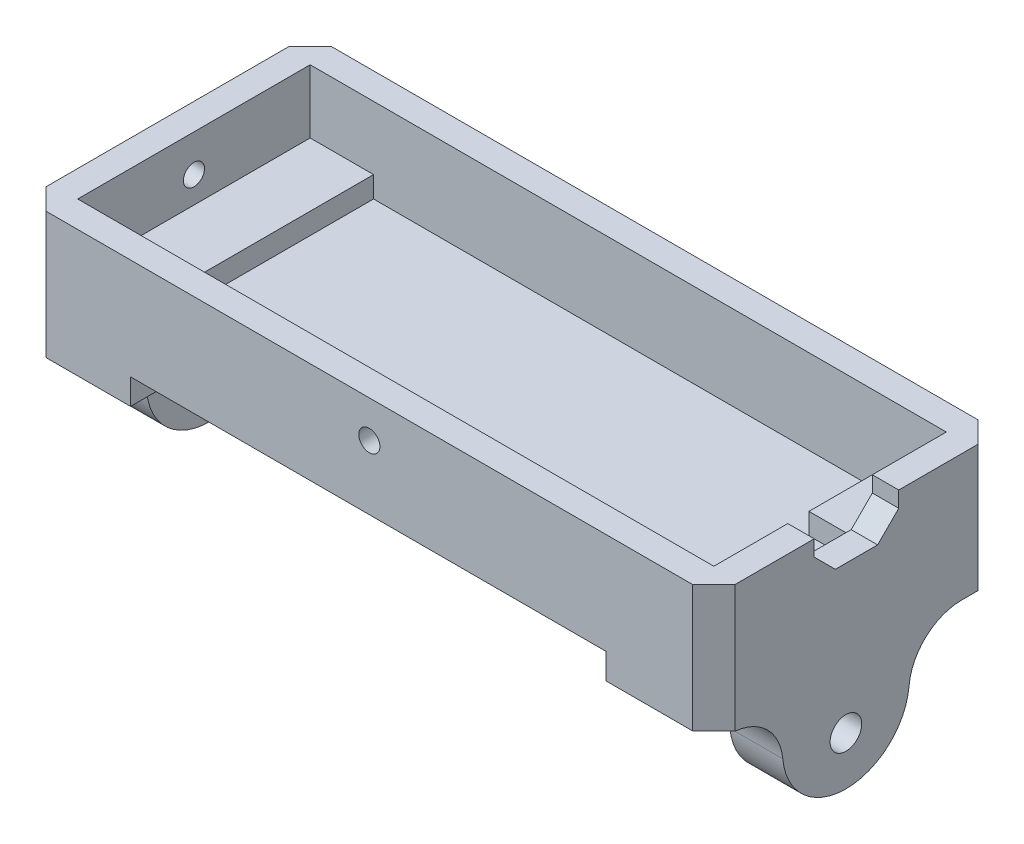
from build123d import *

# Parameters (mm, degrees)
SKETCH1_W                = 60.2
SKETCH1_H                = 22
BOSS_EXTRUDE1_DEPTH      = 10
SKETCH1_3_W              = 60.2
SKETCH1_3_H              = 22
BOSS_EXTRUDE2_DEPTH      = 2
SKETCH2_W                = 6
SKETCH2_H                = 22
BOSS_EXTRUDE3_DEPTH      = 2
BOSS_EXTRUDE4_DEPTH      = 2
FILLET1_R                = 0.5
CUT_EXTRUDE1_DEPTH       = 10.5
SKETCH5_W                = 5
SKETCH5_H                = 9
BOSS_EXTRUDE5_DEPTH      = 5
SKETCH7_W                = 3.5
SKETCH7_H                = 5
SKETCH7_W_2              = 2.5
CUT_EXTRUDE3_DEPTH       = 5
CUT_EXTRUDE4_REACH       = 52.1
CUT_EXTRUDE5_REACH       = 52.1
SKETCH11_R               = 1.5
CUT_EXTRUDE6_START       = -10
CUT_EXTRUDE6_DEPTH       = 45
SKETCH13_W               = 6
SKETCH13_H               = 8.020209914
CUT_EXTRUDE7_DEPTH       = 2
SKETCH19_R               = 1
CUT_EXTRUDE9_DEPTH       = 6
SKETCH20_R               = 1
CUT_EXTRUDE10_DEPTH      = 6
CUT_EXTRUDE13_DEPTH      = 23
CUT_EXTRUDE13_DEPTH_BACK = 23
SKETCH24_W               = 5
SKETCH24_H               = 12
BOSS_EXTRUDE6_DEPTH      = 10
FILLET2_R                = 6
SKETCH25_R               = 1.5
CUT_EXTRUDE14_DEPTH      = 68.910603458
FILLET3_R                = 5


# Some blends are built 0.0001 mm under size
with BuildPart() as part:
    # Sketch1 → Boss-Extrude1 (new body)
    with BuildSketch(Plane(origin=(0, 0, 0), x_dir=(1, 0, 0), z_dir=(0, 1, 0))):
        Polygon((-30.2, 14.719403234), (31, 14.719403234), (33, 12.719403234), (33, -10.280596766), (31, -12.280596766), (-30.2, -12.280596766), (-32.2, -10.280596766), (-32.2, 12.719403234), align=None)
        with Locations((0.4, 1.219403234)):
            Rectangle(SKETCH1_W, SKETCH1_H, mode=Mode.SUBTRACT)
    extrude(amount=BOSS_EXTRUDE1_DEPTH)

    # Sketch1<3> → Boss-Extrude2 (add)
    # profile 1 of 2: a face of its own
    with BuildSketch(Plane(origin=(0, 0, 0), x_dir=(1, 0, 0), z_dir=(0, 1, 0))):
        with Locations((0.4, 1.219403234)):
            Rectangle(SKETCH1_3_W, SKETCH1_3_H)
        with BuildLine():
            Line((19, 11.719403234), (19, 4.719403234))
            ThreePointArc((19, 4.719403234), (21, 2.719403234), (23, 4.719403234))
            Line((23, 4.719403234), (23, 8.719403234))
            Line((23, 8.719403234), (27.74387368, 8.719403234))
            Line((27.74387368, 8.719403234), (29, 7.463276914))
            Line((29, 7.463276914), (29, -6.35040845))
            Line((29, -6.35040845), (21, -9.280596766))
            Line((21, -9.280596766), (-19, -9.280596766))
            Line((-19, -9.280596766), (-29, -3.280596766))
            Line((-29, -3.280596766), (-29, 6.719403234))
            Line((-29, 6.719403234), (-19, 11.719403234))
            Line((-19, 11.719403234), (-10, 11.719403234))
            Line((-10, 11.719403234), (-9.484452133, 10.971768721))
            ThreePointArc((-9.484452133, 10.971768721), (-9.305293031, 10.812937389), (-9.07282975, 10.755612013))
            Line((-9.07282975, 10.755612013), (-6.967125689, 10.755612013))
            ThreePointArc((-6.967125689, 10.755612013), (-6.742443017, 10.808937974), (-6.565686023, 10.957541226))
            Line((-6.565686023, 10.957541226), (-6, 11.719403234))
            Line((-6, 11.719403234), (19, 11.719403234))
        make_face(mode=Mode.SUBTRACT)
    # profile 2 of 2: a face of its own
    with BuildSketch(Plane(origin=(0, 0, 0), x_dir=(1, 0, 0), z_dir=(0, 1, 0))):
        with BuildLine():
            ThreePointArc((19, 4.719403234), (21, 2.719403234), (23, 4.719403234))
            Line((23, 4.719403234), (23, 8.719403234))
            Line((23, 8.719403234), (27.74387368, 8.719403234))
            Line((27.74387368, 8.719403234), (29, 7.463276914))
            Line((29, 7.463276914), (29, -6.35040845))
            Line((29, -6.35040845), (21, -9.280596766))
            Line((21, -9.280596766), (-19, -9.280596766))
            Line((-19, -9.280596766), (-29, -3.280596766))
            Line((-29, -3.280596766), (-29, 6.719403234))
            Line((-29, 6.719403234), (-19, 11.719403234))
            Line((-19, 11.719403234), (-10, 11.719403234))
            Line((-10, 11.719403234), (-9.484452133, 10.971768721))
            ThreePointArc((-9.484452133, 10.971768721), (-9.305293031, 10.812937389), (-9.07282975, 10.755612013))
            Line((-9.07282975, 10.755612013), (-6.967125689, 10.755612013))
            ThreePointArc((-6.967125689, 10.755612013), (-6.742443017, 10.808937974), (-6.565686023, 10.957541226))
            Line((-6.565686023, 10.957541226), (-6, 11.719403234))
            Line((-6, 11.719403234), (19, 11.719403234))
            Line((19, 11.719403234), (19, 4.719403234))
        make_face()
    extrude(amount=BOSS_EXTRUDE2_DEPTH)

    # Sketch2 → Boss-Extrude3 (add)
    with BuildSketch(Plane(origin=(0, 2, 0), x_dir=(1, 0, 0), z_dir=(0, 1, 0))):
        with Locations((-26.7, 1.219403234)):
            Rectangle(SKETCH2_W, SKETCH2_H)
        with Locations((27.5, 1.219403234)):
            Rectangle(SKETCH2_W, SKETCH2_H)
    extrude(amount=BOSS_EXTRUDE3_DEPTH)

    # Sketch3 → Boss-Extrude4 (add)
    with BuildSketch(Plane.XZ):
        Polygon((-32.2, 14.280596766), (36, 14.280596766), (41, 9.280596766), (41, -11.719403234), (36, -16.719403234), (-32.2, -16.719403234), (-37.2, -11.719403234), (-37.2, 9.280596766), align=None)
    extrude(amount=BOSS_EXTRUDE4_DEPTH)

    # Fillet1
    fillet1_edges = [part.edges().sort_by_distance(p)[0] for p in [
        (0.4, 0, -14.719403234),
        (32, 0, -13.719403234),
    ]]
    fillet(fillet1_edges, radius=FILLET1_R)

    # Sketch4 → Cut-Extrude1 (cut)
    with BuildSketch(Plane(origin=(33, 0, 0), x_dir=(0, 0, -1), z_dir=(1, 0, 0))):
        Polygon((-2.780596766, 10), (5.219403234, 10), (5.219403234, 8.5), (3.219403234, 6.5), (-0.780596766, 6.5), (-2.780596766, 8.5), align=None)
    extrude(amount=-CUT_EXTRUDE1_DEPTH, mode=Mode.SUBTRACT)

    # Sketch5 → Boss-Extrude5 (add)
    with BuildSketch(Plane(origin=(0, 0, 0), x_dir=(-1, 0, 0), z_dir=(0, 1, 0))):
        with Locations((-35.5, 9.280596766)):
            Rectangle(SKETCH5_W, SKETCH5_H)
        with Locations((-35.5, -9.719403234)):
            Rectangle(SKETCH5_W, SKETCH5_H)
    extrude(amount=BOSS_EXTRUDE5_DEPTH)

    # Sketch7 → Cut-Extrude3 (cut)
    with BuildSketch(Plane(origin=(38, 0, 0), x_dir=(0, 0, -1), z_dir=(1, 0, 0))):
        with Locations((-12.030596766, 2.5)):
            Rectangle(SKETCH7_W, SKETCH7_H)
        with Locations((13.969403234, 2.5)):
            Rectangle(SKETCH7_W_2, SKETCH7_H)
    extrude(amount=-CUT_EXTRUDE3_DEPTH, mode=Mode.SUBTRACT)

    # Sketch10 → Cut-Extrude4 (cut, up to next)
    with BuildSketch(Plane(origin=(0, 0, -12.719403234), x_dir=(-1, 0, 0), z_dir=(0, 0, -1)), mode=Mode.PRIVATE) as cut_extrude4_sk1:
        with BuildLine():
            Line((-35.5, 5), (-38, 5))
            Line((-38, 5), (-38, 2.5))
            ThreePointArc((-38, 2.5), (-37.267766953, 4.267766953), (-35.5, 5))
        make_face()
    cut_extrude4_tool1 = extrude(cut_extrude4_sk1.sketch, amount=-CUT_EXTRUDE4_REACH, mode=Mode.PRIVATE) & part.part
    # Sketch10 → Cut-Extrude4 (cut, up to next)
    with BuildSketch(Plane(origin=(0, 0, -12.719403234), x_dir=(-1, 0, 0), z_dir=(0, 0, -1)), mode=Mode.PRIVATE) as cut_extrude4_sk2:
        with BuildLine():
            ThreePointArc((-35.5, 0), (-37.267766953, 0.732233047), (-38, 2.5))
            Line((-38, 2.5), (-38, 0))
            Line((-38, 0), (-35.5, 0))
        make_face()
    cut_extrude4_tool2 = extrude(cut_extrude4_sk2.sketch, amount=-CUT_EXTRUDE4_REACH, mode=Mode.PRIVATE) & part.part
    add(cut_extrude4_tool1.solids().sort_by_distance((37.44158, 4.44158, -12.719403))[0], mode=Mode.SUBTRACT)
    add(cut_extrude4_tool1.solids().sort_by_distance((37.44158, 4.44158, -12.719403))[1], mode=Mode.SUBTRACT)
    add(cut_extrude4_tool2.solids().sort_by_distance((37.44158, 0.55842, -12.719403))[0], mode=Mode.SUBTRACT)
    add(cut_extrude4_tool2.solids().sort_by_distance((37.44158, 0.55842, -12.719403))[1], mode=Mode.SUBTRACT)

    # Cut-Extrude5: up to this face of the body (flat: up to its plane)
    cut_extrude5_end = Plane(part.part.faces().sort_by_distance((35.266625353, 2.5, 10.280596766))[0])
    # Sketch11 → Cut-Extrude5 (cut, up to the picked face)
    with BuildSketch(Plane(origin=(0, 0, -12.719403234), x_dir=(-1, 0, 0), z_dir=(0, 0, -1)), mode=Mode.PRIVATE) as cut_extrude5_sk1:
        with Locations((-35.5, 2.5)):
            Circle(SKETCH11_R)
    cut_extrude5_tool1 = split(extrude(cut_extrude5_sk1.sketch, amount=-CUT_EXTRUDE5_REACH, mode=Mode.PRIVATE), bisect_by=cut_extrude5_end, keep=Keep.BOTH, mode=Mode.PRIVATE)
    add(cut_extrude5_tool1.solids().sort_by(Axis((35.5, 2.5, -12.719403), (0, 0, 1)))[0], mode=Mode.SUBTRACT)

    # Sketch12 → Cut-Extrude6 (cut)
    with BuildSketch(Plane.ZY.offset(32.2).offset(CUT_EXTRUDE6_START)):
        Polygon((14.280596766, -2), (14.280596766, 2.423920323), (9.856676443, -2), align=None)
        Polygon((-12.295482911, -2), (-16.719403234, -2), (-16.719403234, 2.423920323), align=None)
    extrude(amount=-CUT_EXTRUDE6_DEPTH, mode=Mode.SUBTRACT)

    # Sketch13 → Cut-Extrude7 (cut)
    with BuildSketch(Plane(origin=(0, 4, 0), x_dir=(1, 0, 0), z_dir=(0, 1, 0))):
        with Locations((27.5, 1.209298277)):
            Rectangle(SKETCH13_W, SKETCH13_H)
    extrude(amount=-CUT_EXTRUDE7_DEPTH, mode=Mode.SUBTRACT)

    # Sketch19 → Cut-Extrude9 (cut)
    with BuildSketch(Plane.ZY.offset(32.2)):
        with Locations((-1.219403234, 6.5)):
            Circle(SKETCH19_R)
    extrude(amount=-CUT_EXTRUDE9_DEPTH, mode=Mode.SUBTRACT)

    # Sketch20 → Cut-Extrude10 (cut)
    with BuildSketch(Plane.XY.offset(12.280596766)):
        with Locations((0.4, 6.503920323)):
            Circle(SKETCH20_R)
    extrude(amount=-CUT_EXTRUDE10_DEPTH, mode=Mode.SUBTRACT)

    # Sketch21 → Cut-Extrude13 (cut, two sides: drawn at the far end of the back side and taken through both)
    with BuildSketch(Plane(origin=(0, 0, 0), x_dir=(1, 0, 0), z_dir=(0, 1, 0)).offset(-CUT_EXTRUDE13_DEPTH_BACK)):
        Polygon((-32.2, -14.280596766), (-22.2, -14.280596766), (-22.2, -12.280596766), (-30.2, -12.280596766), (-32.2, -10.280596766), (-32.2, 12.719403234), (-29.7, 15.219403234), (-22.2, 15.219403234), (-22.2, 16.719403234), (-32.2, 16.719403234), (-37.2, 11.719403234), (-37.2, -9.280596766), align=None)
        Polygon((-22.2, 14.724471537), (-22.2, 15.219403234), (-29.7, 15.219403234), (-30.2, 14.719403234), align=None)
        Polygon((33, 12.719403234), (33, -10.280596766), (31, -12.280596766), (22.8, -12.280596766), (22.8, -14.280596766), (36, -14.280596766), (41, -9.280596766), (41, 11.719403234), (36, 16.719403234), (22.8, 16.719403234), (22.8, 15.219403234), (22.8, 14.724471537), (31, 14.719403234), align=None)
    extrude(amount=CUT_EXTRUDE13_DEPTH + CUT_EXTRUDE13_DEPTH_BACK, mode=Mode.SUBTRACT)

    # Sketch24 → Boss-Extrude6 (add)
    with BuildSketch(Plane.XZ.offset(2)):
        with Locations((-29.7, -0.219403234)):
            Rectangle(SKETCH24_W, SKETCH24_H)
        with Locations((30.5, -0.219403234)):
            Rectangle(SKETCH24_W, SKETCH24_H)
    extrude(amount=BOSS_EXTRUDE6_DEPTH)

    # Fillet2
    fillet2_edges = [part.edges().sort_by_distance(p)[0] for p in [
        (30.5, -12, -6.219403234),
        (30.5, -12, 5.780596766),
        (-29.7, -12, 5.780596766),
        (-29.7, -12, -6.219403234),
    ]]
    fillet(fillet2_edges, radius=FILLET2_R - 0.0001)  # a hair under: the kernel refuses the full size

    # Sketch25 → Cut-Extrude14 (cut, through all)
    with BuildSketch(Plane.ZY.offset(32.2)):
        with Locations((-0.219403234, -7.409023834)):
            Circle(SKETCH25_R)
    extrude(amount=-CUT_EXTRUDE14_DEPTH, mode=Mode.SUBTRACT)

    # Fillet3
    # the kernel refuses this fillet: 5 mm, written as the material it adds along each edge
    with BuildSketch(Plane(origin=(33, -2, 5.780596766), x_dir=(0, 0, 1), z_dir=(-1, 0, 0))) as fillet3_piece_1_section:
        with BuildLine():
            CenterArc((4.954459863, -5), FILLET3_R, 90, 84.784566921)
            Line((-0.024839887, -4.545495868), (-0.522769862, -4.500045455))
            ThreePointArc((-0.522769862, -4.500045455), (-0.5, -4.0001), (-0.5, 0))
            Line((-0.5, 0), (0, 0.5))
            Line((0, 0.5), (4.954459863, 0.5))
            Line((4.954459863, 0.5), (4.954459863, 0))
        make_face()
    fillet3_piece_1 = extrude(amount=5, mode=Mode.PRIVATE)
    fillet3_piece_1 = split(fillet3_piece_1, bisect_by=Plane(origin=(31.767986463, -2.014062206, 11.512610303), z_dir=(-0.7071067811865495, 0, -0.7071067811865457)), keep=Keep.TOP, mode=Mode.PRIVATE)
    add(fillet3_piece_1)
    with BuildSketch(Plane(origin=(-32.2, -2, 5.780596766), x_dir=(0, 0, 1), z_dir=(1, 0, 0))) as fillet3_piece_2_section:
        with BuildLine():
            CenterArc((4.954459863, 5), FILLET3_R, 185.215433079, 84.784566921)
            Line((-0.024839887, 4.545495868), (-0.522769862, 4.500045455))
            ThreePointArc((-0.522769862, 4.500045455), (-0.5, 4.0001), (-0.5, 0))
            Line((-0.5, 0), (0, -0.5))
            Line((0, -0.5), (4.954459863, -0.5))
            Line((4.954459863, -0.5), (4.954459863, 0))
        make_face()
    fillet3_piece_2 = extrude(amount=5, mode=Mode.PRIVATE)
    fillet3_piece_2 = split(fillet3_piece_2, bisect_by=Plane(origin=(-30.967986463, -2.014062206, 11.512610303), z_dir=(0.7071067811865481, 0, -0.7071067811865469)), keep=Keep.TOP, mode=Mode.PRIVATE)
    add(fillet3_piece_2)
    with BuildSketch(Plane(origin=(-27.2, -2, -6.219403234), x_dir=(0, -0.99998506872255, 0.005464643808789093), z_dir=(-1, 0, 0))) as fillet3_piece_3:
        with BuildLine():
            CenterArc((4.972850985, -4.981709105), FILLET3_R, 94.902330493, 84.784566921)
            Line((-0.027074358, -4.954385886), (-0.527066893, -4.951653564))
            Line((-0.527066893, -4.951653564), (-0.499992534, 0.002732322))
            Line((-0.499992534, 0.002732322), (0.002732322, 0.499992534))
            ThreePointArc((0.002732322, 0.499992534), (4.002772595, 0.478133413), (4.502835015, 0.498170911))
            Line((4.502835015, 0.498170911), (4.545563739, 0))
        make_face()
    extrude(amount=5)
    with BuildSketch(Plane(origin=(28, -2, -6.219403234), x_dir=(0, 0, -1), z_dir=(1, 0, 0))) as fillet3_piece_4:
        with BuildLine():
            CenterArc((4.954459863, -5), FILLET3_R, 90, 84.784566921)
            Line((-0.024839887, -4.545495868), (-0.522769862, -4.500045455))
            ThreePointArc((-0.522769862, -4.500045455), (-0.5, -4.0001), (-0.5, 0))
            Line((-0.5, 0), (0, 0.5))
            Line((0, 0.5), (4.954459863, 0.5))
            Line((4.954459863, 0.5), (4.954459863, 0))
        make_face()
    extrude(amount=5)


solid = part.part
